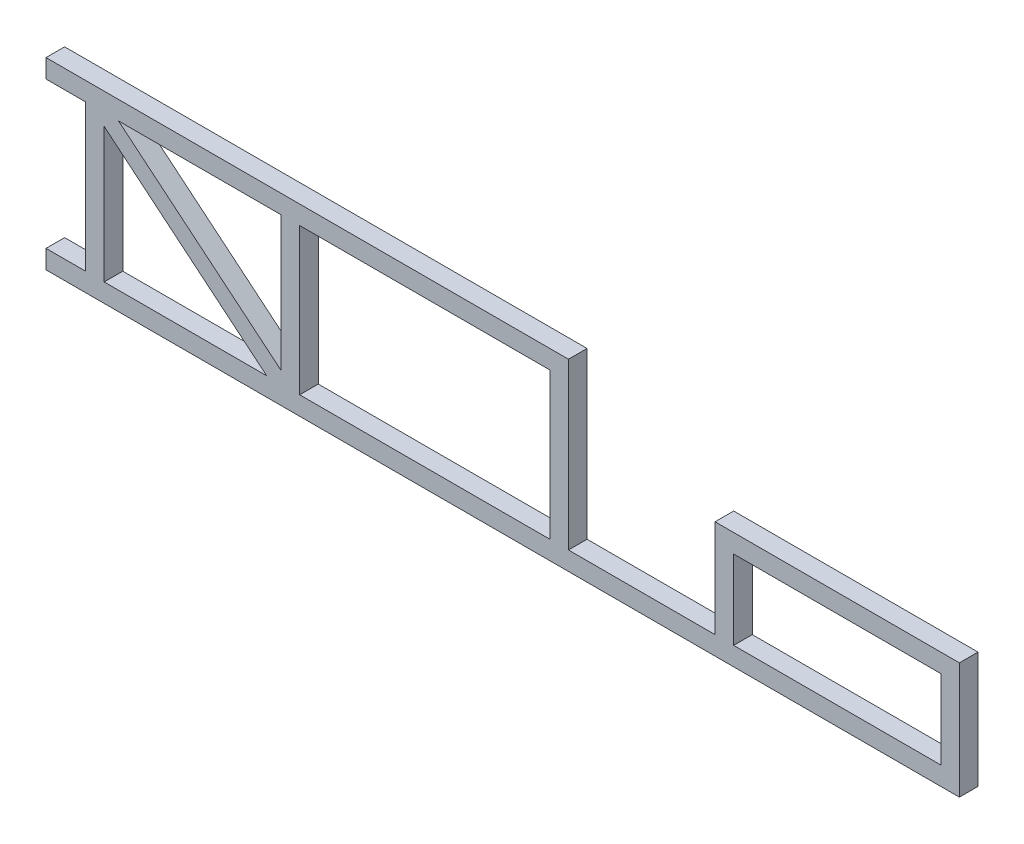
from build123d import *

# Parameters (mm, degrees)
SKETCH1_W           = 511.95
SKETCH1_H           = 300
SKETCH1_W_2         = 423.8
SKETCH1_H_2         = 161.9
BOSS_EXTRUDE1_DEPTH = 38.1
SHELL1_START        = -34.925
SHELL1_OUTLINE_W    = 430.15
SHELL1_OUTLINE_H    = 168.25
SHELL1_OUTLINE_W_2  = 518.3
SHELL1_OUTLINE_H_2  = 306.35
SHELL1_DEPTH        = 31.75


# Read off the part's stored shape, not the designer's step: Shell1
with BuildPart() as part:
    # Sketch1 → Boss-Extrude1 (new body)
    with BuildSketch(Plane.XY):
        Polygon((0, 0), (1850, 0), (1869.05, 0), (1869.05, 38.1), (1869.05, 238.1), (1369.05, 238.1), (1369.05, 38.1), (1069.1, 38.1), (1069.1, 338.1), (1069.1, 376.2), (0, 376.2), (0, 338.1), (80.95, 338.1), (80.95, 38.1), (0, 38.1), align=None)
        with Locations((775.025, 188.1)):
            Rectangle(SKETCH1_W, SKETCH1_H, mode=Mode.SUBTRACT)
        Polygon((451.617753988, 38.1), (119.05, 38.1), (119.05, 313.784791922), align=None, mode=Mode.SUBTRACT)
        Polygon((148.382246012, 338.1), (480.95, 338.1), (480.95, 62.415208078), align=None, mode=Mode.SUBTRACT)
        with Locations((1619.05, 119.05)):
            Rectangle(SKETCH1_W_2, SKETCH1_H_2, mode=Mode.SUBTRACT)
    extrude(amount=-BOSS_EXTRUDE1_DEPTH)

    # Shell1 outline → Shell1 (cut)
    with BuildSketch(Plane.XY.offset(SHELL1_START)):
        Polygon((84.125, 34.925), (3.175, 34.925), (3.175, 3.175), (1865.875, 3.175), (1865.875, 234.925), (1372.225, 234.925), (1372.225, 34.925), (1065.925, 34.925), (1065.925, 373.025), (3.175, 373.025), (3.175, 341.275), (84.125, 341.275), align=None)
        Polygon((460.42283517, 34.925), (115.875, 34.925), (115.875, 320.540779362), align=None, mode=Mode.SUBTRACT)
        with Locations((1619.05, 119.05)):
            Rectangle(SHELL1_OUTLINE_W, SHELL1_OUTLINE_H, mode=Mode.SUBTRACT)
        Polygon((139.57716483, 341.275), (484.125, 341.275), (484.125, 55.659220638), align=None, mode=Mode.SUBTRACT)
        with Locations((775.025, 188.1)):
            Rectangle(SHELL1_OUTLINE_W_2, SHELL1_OUTLINE_H_2, mode=Mode.SUBTRACT)
    extrude(amount=SHELL1_DEPTH, mode=Mode.SUBTRACT)


solid = part.part
